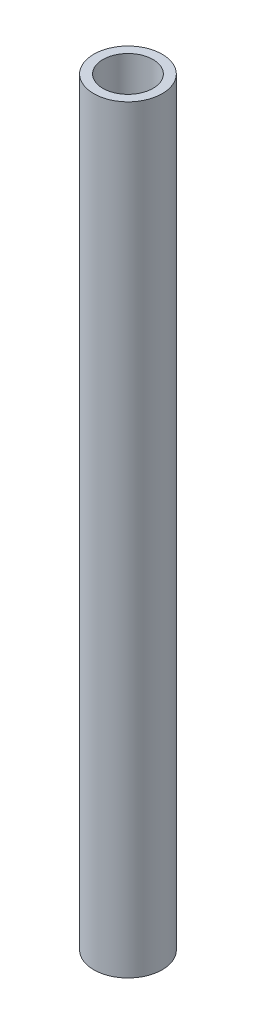
from build123d import *

# Parameters (mm, degrees)
SKETCH1_R           = 0.45085
SKETCH1_R_2         = 0.3302
BOSS_EXTRUDE1_DEPTH = 10


with BuildPart() as part:
    # Sketch1 → Boss-Extrude1 (new body)
    with BuildSketch(Plane(origin=(0, 0, 0), x_dir=(1, 0, 0), z_dir=(0, 1, 0))):
        Circle(SKETCH1_R)
        Circle(SKETCH1_R_2, mode=Mode.SUBTRACT)
    extrude(amount=BOSS_EXTRUDE1_DEPTH)


solid = part.part
